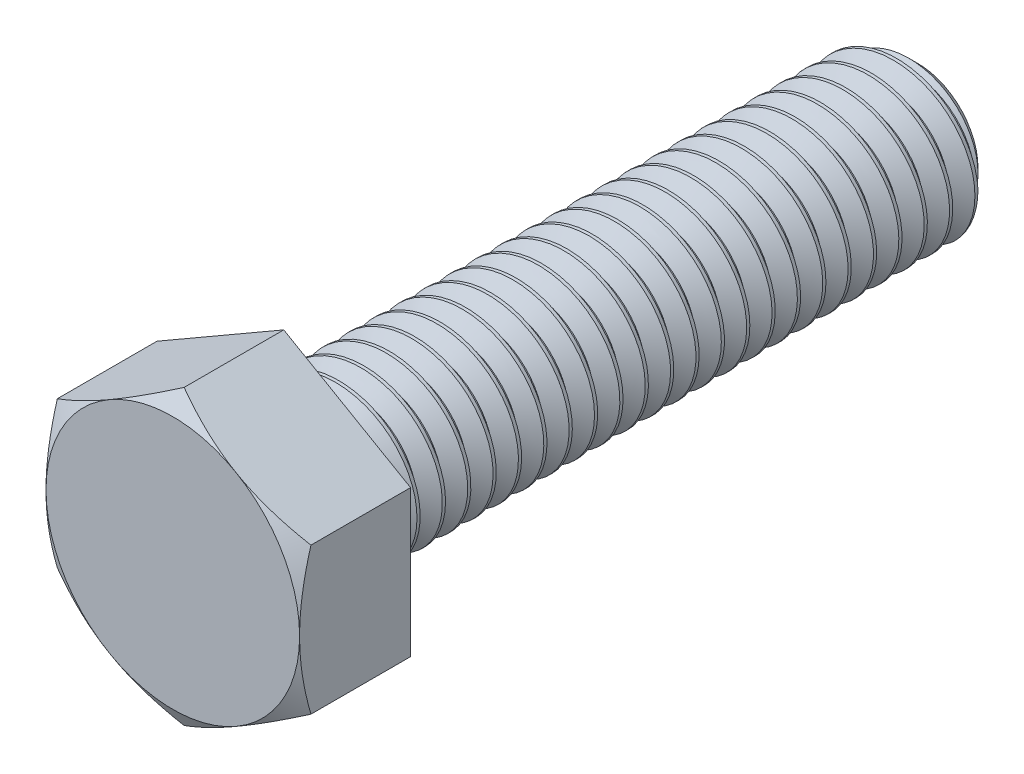
from build123d import *

# Parameters (mm, degrees)
BOSS_EXTRUDE1_DEPTH = 3.5
SKETCH4_OUTSIDE_W   = 102.874
SKETCH4_OUTSIDE_H   = 104.112
SKETCH4_OUTSIDE_R   = 4
CUT_EXTRUDE1_DEPTH  = 25.281337141
CUT_EXTRUDE1_DRAFT  = -60
CUT_SWEEP1_PITCH    = 0.8
CUT_SWEEP1_TO       = 20


with BuildPart() as part:
    # Sketch2 → Revolve1 (revolve)
    with BuildSketch(Plane(origin=(0, 0, 0), x_dir=(0, 0, -1), z_dir=(1, 0, 0)), mode=Mode.PRIVATE) as revolve1_sk:
        Polygon((-11.75, 4), (-11.75, 0), (11.75, 0), (11.75, 1.9), (11.15, 2.5), (-8.25, 2.5), (-8.25, 4), align=None)
    revolve(revolve1_sk.sketch.rotate(Axis((0, 0, 11.75), (0, 0, -1)), 90), axis=Axis((0, 0, 11.75), (0, 0, -1)))

    # Sketch3 → Boss-Extrude1 (add)
    with BuildSketch(Plane.XY.offset(11.75)):
        Polygon((0, 4.618802154), (-4, 2.309401077), (-4, -2.309401077), (0, -4.618802154), (4, -2.309401077), (4, 2.309401077), align=None)
    extrude(amount=-BOSS_EXTRUDE1_DEPTH)


with BuildPart() as cut_extrude1_tool:
    # Sketch4 outside → Cut-Extrude1 (with draft: the straight prism first)
    with BuildSketch(Plane.XY.offset(11.75)):
        Rectangle(SKETCH4_OUTSIDE_W, SKETCH4_OUTSIDE_H)
        Circle(SKETCH4_OUTSIDE_R, mode=Mode.SUBTRACT)
    extrude(amount=-CUT_EXTRUDE1_DEPTH)
    # Cut-Extrude1: the draft: its side faces are tilted about the plane it starts from
    cut_extrude1_sides = [cut_extrude1_tool.faces().sort_by_distance(p)[0] for p in [
        (0, -52.056, -0.89066857),
        (51.437, 0, -0.89066857),
        (0, 52.056, -0.89066857),
        (-51.437, 0, -0.89066857),
        (-4, 0, -0.89066857),
    ]]
    draft(cut_extrude1_sides, Plane.XY.offset(11.75), CUT_EXTRUDE1_DRAFT)


with BuildPart() as part_1:
    add(part.part)

    # Cut-Extrude1: cut by cut_extrude1_tool
    add(cut_extrude1_tool.part, mode=Mode.SUBTRACT)


with BuildPart() as body_2:
    # Split1: read off the stored shape, not the designer's step
    # Split1: the piece on the far side of the plane
    add(part_1.part)
    split(bisect_by=Plane.XY.offset(8.25), keep=Keep.BOTTOM)

    # Cut-Sweep1: arcs per turn and ends read off the stored shape
    # Cut-Sweep1: the profile of Sketch7 screwed along a right-hand helix through 26 turns, 8 arcs to a turn; built about Z, then put on its axis
    cut_sweep1_z = Axis((0, 0, 0), (0, 0, 1))
    cut_sweep1_corners = [(2.54330127, 0, 0.025), (1.980384758, 0, -0.3), (1.980384758, 0, -0.4), (2.54330127, 0, -0.725)]
    with BuildLine(mode=Mode.PRIVATE) as cut_sweep1_profile:
        Line(cut_sweep1_corners[0], cut_sweep1_corners[1])
        Line(cut_sweep1_corners[1], cut_sweep1_corners[2])
        Line(cut_sweep1_corners[2], cut_sweep1_corners[3])
        Line(cut_sweep1_corners[3], cut_sweep1_corners[0])
    cut_sweep1_cap = Face(cut_sweep1_profile.wire())
    cut_sweep1_turn_angles = [0, 22.5, 45, 67.5, 90, 112.5, 135, 157.5, 180, 202.5, 225, 247.5, 270, 292.5, 315, 337.5, 360]
    cut_sweep1_turn_weights = [1, 0.9238795325112867, 1, 0.9238795325112867, 1, 0.9238795325112867, 1, 0.9238795325112867, 1, 0.9238795325112867, 1, 0.9238795325112867, 1, 0.9238795325112867, 1, 0.9238795325112867, 1]
    cut_sweep1_turn_rails = [Edge.make_bspline([Vector(p[0], p[1], 0).rotate(cut_sweep1_z, cut_sweep1_turn_angles[k]) / cut_sweep1_turn_weights[k] + Vector(0, 0, p[2] + CUT_SWEEP1_PITCH * cut_sweep1_turn_angles[k] / 360) for k in range(17)], [0, 0, 0, 1, 1, 2, 2, 3, 3, 4, 4, 5, 5, 6, 6, 7, 7, 8, 8, 8], 2, cut_sweep1_turn_weights) for p in cut_sweep1_corners]
    cut_sweep1_turn_sides = [Face.make_surface_from_curves(cut_sweep1_turn_rails[p[0]], cut_sweep1_turn_rails[p[1]]) for p in [(0, 1), (1, 2), (2, 3), (3, 0)]]
    cut_sweep1 = Plane(origin=(0, 0, -11.75), x_dir=(0, 1, 0), z_dir=(0, 0, 1)) * split(Solid(Shell([*[p.moved(Location((0, 0, CUT_SWEEP1_PITCH * i))) for i in range(26) for p in cut_sweep1_turn_sides], cut_sweep1_cap, cut_sweep1_cap.rotate(cut_sweep1_z, 9360).moved(Location((0, 0, CUT_SWEEP1_PITCH * 9360 / 360)))])), bisect_by=Plane.XY.offset(CUT_SWEEP1_TO), keep=Keep.BOTTOM, mode=Mode.PRIVATE)
    add(cut_sweep1, mode=Mode.SUBTRACT)


with BuildPart() as part_2:
    add(part_1.part)

    # Split1
    split(bisect_by=Plane.XY.offset(8.25), keep=Keep.TOP)

    add(body_2.part)  # Boss-Extrude2 merges body 2
    # Boss-Extrude2: read off the stored shape, not the designer's step
    # Boss-Extrude2 outline → Boss-Extrude2 (revolve)
    with BuildSketch(Plane.XZ):
        Polygon((1.980383799, 8.25), (1.980383799, 6.822366222), (2.5, 8.25), align=None)
    revolve(axis=Axis((0, 0, 0), (0, 0, 1)))


solid = part_2.part
